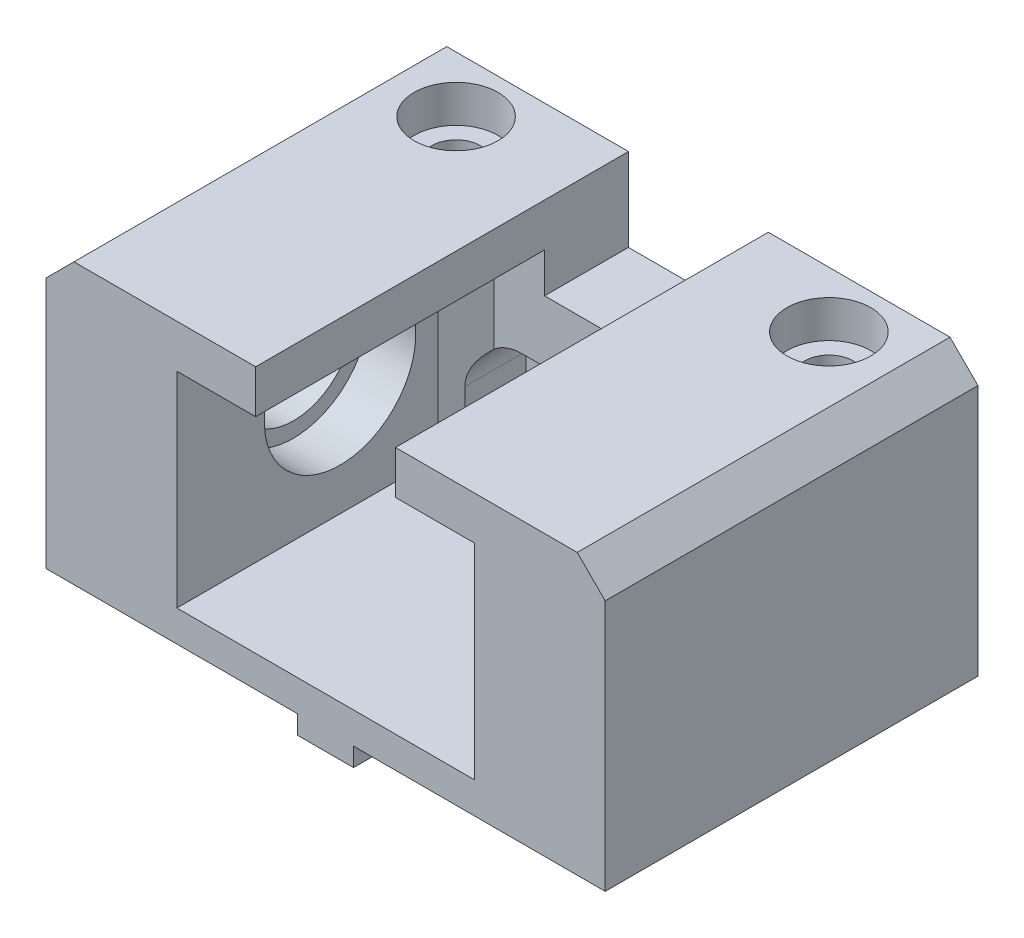
from build123d import *

# Parameters (mm, degrees)
BOSS_EXTRUDE1_DEPTH = 40
SKETCH2_R           = 2.6
BOSS_EXTRUDE2_DEPTH = 9
SKETCH3_R           = 4.5
CUT_EXTRUDE1_DEPTH  = 5
SKETCH4_R           = 2.6
CUT_EXTRUDE2_DEPTH  = 59.309518948
CHAMFER1_SIZE       = 3
SKETCH5_R           = 6.5
CUT_EXTRUDE3_DEPTH  = 55
SKETCH6_R           = 8.125
CUT_EXTRUDE4_DEPTH  = 5
CUT_EXTRUDE5_START  = -5
SKETCH7_R           = 8.125
CUT_EXTRUDE5_DEPTH  = 5
SKETCH8_R           = 8.125
CUT_EXTRUDE6_DEPTH  = 5
SKETCH9_R           = 4.5
CUT_EXTRUDE7_DEPTH  = 4
CHAMFER2_SIZE       = 3
SKETCH10_W          = 6
SKETCH10_H          = 40
BOSS_EXTRUDE3_DEPTH = 2
CUT_EXTRUDE8_DEPTH  = 5
CUT_EXTRUDE9_DEPTH  = 36


with BuildPart() as part:
    # Sketch1 → Boss-Extrude1 (new body)
    with BuildSketch(Plane.XY):
        Polygon((30, -21.341245707), (30, 8.658754293), (7.5, 8.658754293), (7.502146126, 4.017294787), (15.952208639, 4.017294787), (15.952208639, -17.982705213), (-15.952208639, -17.982705213), (-15.952208639, 4.017294787), (-7.502146126, 4.017294787), (-7.5, 8.658754293), (-30, 8.658754293), (-30, -21.341245707), align=None)
    extrude(amount=BOSS_EXTRUDE1_DEPTH)

    # Sketch2 → Boss-Extrude2 (add)
    with BuildSketch(Plane(origin=(0, 0, 0), x_dir=(-1, 0, 0), z_dir=(0, 0, -1))):
        Polygon((-7.502146126, -0.25363415), (-7.502146126, 4.017294787), (-15.952208639, 4.017294787), (-15.952208639, -17.982705213), (-5.499999997, -17.982705213), (-5.499999997, -13.845664874), (-4.999999997, -13.345655401), (5.020834238, -13.345465543), (5.518750814, -13.845451729), (5.50151136, -17.982705213), (15.952208639, -17.982705213), (15.952208639, 4.017294787), (7.502146126, 4.017294787), (7.504120794, -0.253349836), align=None)
        with Locations((-9.99998, -11.341245707)):
            Circle(SKETCH2_R, mode=Mode.SUBTRACT)
        with Locations((9.99998, -11.341245707)):
            Circle(SKETCH2_R, mode=Mode.SUBTRACT)
    extrude(amount=-BOSS_EXTRUDE2_DEPTH)

    # Sketch3 → Cut-Extrude1 (cut)
    with BuildSketch(Plane.XY.offset(9)):
        with Locations((-9.99998, -11.341245707)):
            Circle(SKETCH3_R)
        with Locations((9.99998, -11.341245707)):
            Circle(SKETCH3_R)
    extrude(amount=-CUT_EXTRUDE1_DEPTH, mode=Mode.SUBTRACT)

    # Sketch4 → Cut-Extrude2 (cut, through all)
    with BuildSketch(Plane(origin=(0, 8.658754293, 0), x_dir=(1, 0, 0), z_dir=(0, 1, 0))):
        with Locations(Location((-20, -6, 0), (0, 0, 270))):
            Circle(SKETCH4_R)
        with Locations(Location((20, -6, 0), (0, 0, 90))):
            Circle(SKETCH4_R)
    extrude(amount=-CUT_EXTRUDE2_DEPTH, mode=Mode.SUBTRACT)

    # Chamfer1
    # the kernel refuses this chamfer: 3 mm, written as the material it adds along each edge
    with BuildSketch(Plane(origin=(15.952208639, 4.017294787, 9), x_dir=(0.02749587661058678, 0, 0.9996219169112968), z_dir=(0, -1, 0))) as chamfer1_piece_1_section:
        Polygon((CHAMFER1_SIZE * 0.999621916911, CHAMFER1_SIZE * 0.0274958766106), (-CHAMFER1_SIZE * 0.0274958766106, CHAMFER1_SIZE * 0.999621916911), (0, 0), align=None)
    chamfer1_piece_1 = extrude(amount=22, mode=Mode.PRIVATE)
    chamfer1_piece_1 = chamfer1_piece_1 - Plane(origin=(9.99998, -11.341245707, 10.026917349), x_dir=(1, 0, 0), z_dir=(0, 0, 1)) * Cylinder(4.5, 56, mode=Mode.PRIVATE)
    add(chamfer1_piece_1)
    with BuildSketch(Plane(origin=(-15.952208639, -17.982705213, 9), x_dir=(-0.02749587661058678, 0, 0.9996219169112968), z_dir=(0, 1, 0))) as chamfer1_piece_2_section:
        Polygon((CHAMFER1_SIZE * 0.999621916911, CHAMFER1_SIZE * 0.0274958766106), (-CHAMFER1_SIZE * 0.0274958766106, CHAMFER1_SIZE * 0.999621916911), (0, 0), align=None)
    chamfer1_piece_2 = extrude(amount=22, mode=Mode.PRIVATE)
    chamfer1_piece_2 = chamfer1_piece_2 - Plane(origin=(-9.99998, -11.341245707, 10.026917349), x_dir=(1, 0, 0), z_dir=(0, 0, 1)) * Cylinder(4.5, 56, mode=Mode.PRIVATE)
    add(chamfer1_piece_2)

    # Sketch5 → Cut-Extrude3 (cut)
    with BuildSketch(Plane.ZY.offset(30)):
        with Locations((22.5, -5.341245707)):
            Circle(SKETCH5_R)
    extrude(amount=-CUT_EXTRUDE3_DEPTH, mode=Mode.SUBTRACT)

    # Sketch6 → Cut-Extrude4 (cut)
    with BuildSketch(Plane.ZY.offset(30)):
        with Locations((22.5, -5.341245707)):
            Circle(SKETCH6_R)
    extrude(amount=-CUT_EXTRUDE4_DEPTH, mode=Mode.SUBTRACT)

    # Sketch7 → Cut-Extrude5 (cut)
    with BuildSketch(Plane(origin=(-15.952208639, 0, 0), x_dir=(0, 0, -1), z_dir=(1, 0, 0)).offset(CUT_EXTRUDE5_START)):
        with Locations(Location((-22.5, -5.341245707, 0), (0, 0, 180))):
            Circle(SKETCH7_R)
    extrude(amount=CUT_EXTRUDE5_DEPTH, mode=Mode.SUBTRACT)

    # Sketch8 → Cut-Extrude6 (cut)
    with BuildSketch(Plane.ZY.offset(-15.952208639)):
        with Locations((22.5, -5.341245707)):
            Circle(SKETCH8_R)
    extrude(amount=-CUT_EXTRUDE6_DEPTH, mode=Mode.SUBTRACT)

    # Sketch9 → Cut-Extrude7 (cut)
    with BuildSketch(Plane(origin=(0, 8.658754293, 0), x_dir=(1, 0, 0), z_dir=(0, 1, 0))):
        with Locations(Location((20, -6, 0), (0, 0, 270))):
            Circle(SKETCH9_R)
        with Locations(Location((-20, -6, 0), (0, 0, 270))):
            Circle(SKETCH9_R)
    extrude(amount=-CUT_EXTRUDE7_DEPTH, mode=Mode.SUBTRACT)

    # Chamfer2
    chamfer2_edges = [part.edges().sort_by_distance(p)[0] for p in [
        (30, 8.658754293, 20),
        (-30, 8.658754293, 20),
    ]]
    chamfer(chamfer2_edges, length=CHAMFER2_SIZE)

    # Sketch10 → Boss-Extrude3 (add)
    with BuildSketch(Plane.XZ.offset(21.341245707)):
        with Locations((0, 20)):
            Rectangle(SKETCH10_W, SKETCH10_H)
    extrude(amount=BOSS_EXTRUDE3_DEPTH)

    # Sketch11 → Cut-Extrude8 (cut)
    with BuildSketch(Plane.XY.offset(9)):
        with BuildLine():
            Line((9.99998, -6.841245707), (-9.99998, -6.841245707))
            ThreePointArc((-9.99998, -6.841245707), (-5.784946566, -12.917155968), (-12.952208639, -14.737470974))
            Line((-12.952208639, -14.737470974), (-12.952208639, -17.982705213))
            Line((-12.952208639, -17.982705213), (-5.50151136, -17.982705213))
            Line((-5.50151136, -17.982705213), (-5.518750814, -13.845451729))
            Line((-5.518750814, -13.845451729), (-5.020834238, -13.345465543))
            Line((-5.020834238, -13.345465543), (4.999999997, -13.345655401))
            Line((4.999999997, -13.345655401), (5.499999997, -13.845664874))
            Line((5.499999997, -13.845664874), (5.499999997, -17.982705213))
            Line((5.499999997, -17.982705213), (12.952208639, -17.982705213))
            Line((12.952208639, -17.982705213), (12.952208639, -14.737470974))
            ThreePointArc((12.952208639, -14.737470974), (5.784946566, -12.917155968), (9.99998, -6.841245707))
        make_face()
        with BuildLine():
            Line((-12.952208639, -17.982705213), (-12.952208639, -14.737470974))
            ThreePointArc((-12.952208639, -14.737470974), (-14.081267005, -13.236792167), (-14.499514384, -11.405978467))
            Line((-14.499514384, -11.405978467), (-14.452208639, -17.982705213))
            Line((-14.452208639, -17.982705213), (-12.952208639, -17.982705213))
        make_face()
        with BuildLine():
            ThreePointArc((14.499514384, -11.405978467), (14.081267005, -13.236792167), (12.952208639, -14.737470974))
            Line((12.952208639, -14.737470974), (12.952208639, -17.982705213))
            Line((12.952208639, -17.982705213), (14.452208639, -17.982705213))
            Line((14.452208639, -17.982705213), (14.499514384, -11.405978467))
        make_face()
    extrude(amount=-CUT_EXTRUDE8_DEPTH, mode=Mode.SUBTRACT)

    # Sketch13 → Cut-Extrude9 (cut)
    with BuildSketch(Plane.XY.offset(40)):
        Polygon((-14.49998, -11.341245707), (-14.452208639, -17.982705213), (14.452208639, -17.982705213), (14.49998, -11.341245707), align=None)
    extrude(amount=-CUT_EXTRUDE9_DEPTH, mode=Mode.SUBTRACT)


solid = part.part
